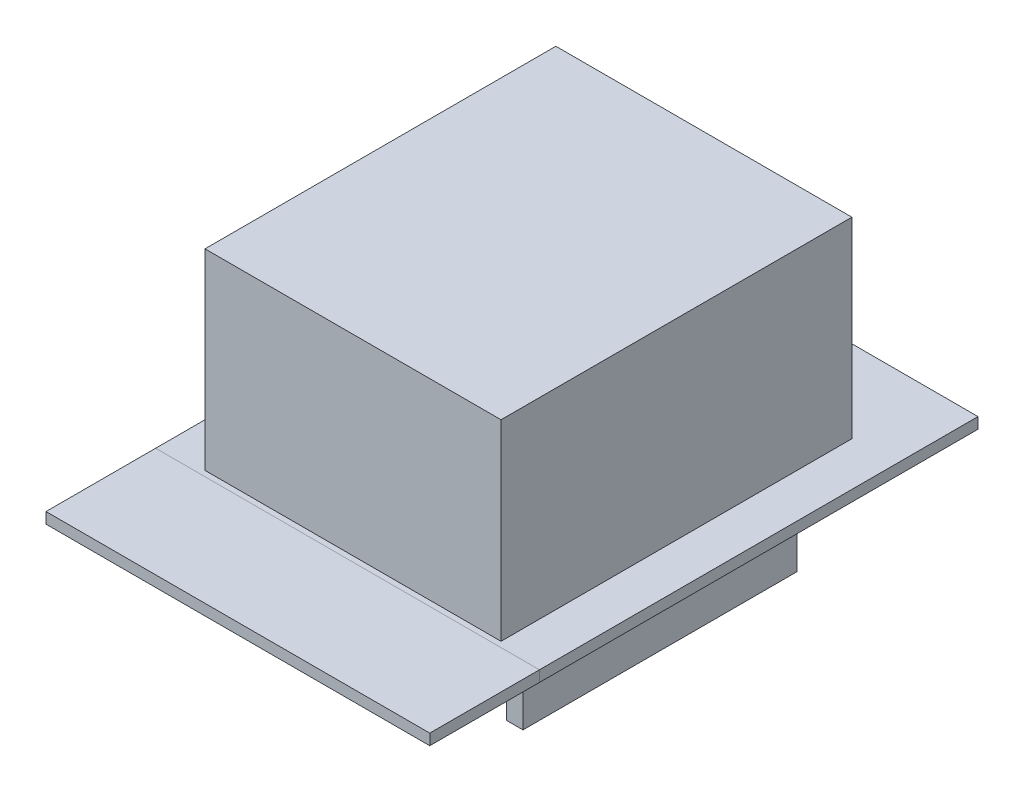
from build123d import *

# Parameters (mm, degrees)
SKETCH1_W             = 70
SKETCH1_H             = 80
BOSS_EXTRUDE1_DEPTH   = 2
SKETCH2_W             = 54
SKETCH2_H             = 64
BOSS_EXTRUDE2_DEPTH   = 35
BOSS_EXTRUDE3_DEPTH   = 20
SKETCH3_3_W           = 3
SKETCH3_3_H           = 9
BOSS_EXTRUDE4_DEPTH   = 50
BOSS_EXTRUDE4_2_DEPTH = 50


with BuildPart() as part:
    # Sketch1 → Boss-Extrude1 (new body)
    with BuildSketch(Plane(origin=(0, 0, 0), x_dir=(1, 0, 0), z_dir=(0, 1, 0))):
        with Locations((-41.191481692, 62.486230982)):
            Rectangle(SKETCH1_W, SKETCH1_H)
    extrude(amount=BOSS_EXTRUDE1_DEPTH)

    # Sketch2 → Boss-Extrude2 (add)
    with BuildSketch(Plane(origin=(0, 2, 0), x_dir=(1, 0, 0), z_dir=(0, 1, 0))):
        with Locations((-41.191481692, 55.486230982)):
            Rectangle(SKETCH2_W, SKETCH2_H)
    extrude(amount=BOSS_EXTRUDE2_DEPTH)


with BuildPart() as body_2:
    # Sketch3 → Boss-Extrude3 (new body)
    with BuildSketch(Plane.XY.offset(-22.486230982)):
        Polygon((-76.191481692, 2), (-76.191481692, 0), (-73.191481692, 0), (-70.191481692, 0), (-12.191481692, 0), (-9.191481692, 0), (-6.191481692, 0), (-6.191481692, 2), align=None)
    extrude(amount=BOSS_EXTRUDE3_DEPTH)


with BuildPart() as body_3:
    # Sketch3<3> → Boss-Extrude4 (new body)
    with BuildSketch(Plane.XY.offset(-22.486230982)):
        with Locations((-71.691481692, -4.5)):
            Rectangle(SKETCH3_3_W, SKETCH3_3_H)
    extrude(amount=-BOSS_EXTRUDE4_DEPTH)


with BuildPart() as body_4:
    # Sketch3<3> → Boss-Extrude4 2 (new body)
    with BuildSketch(Plane.XY.offset(-22.486230982)):
        with Locations((-10.691481692, -4.5)):
            Rectangle(SKETCH3_3_W, SKETCH3_3_H)
    extrude(amount=-BOSS_EXTRUDE4_2_DEPTH)


solid = Compound([part.part, body_2.part, body_3.part, body_4.part])
